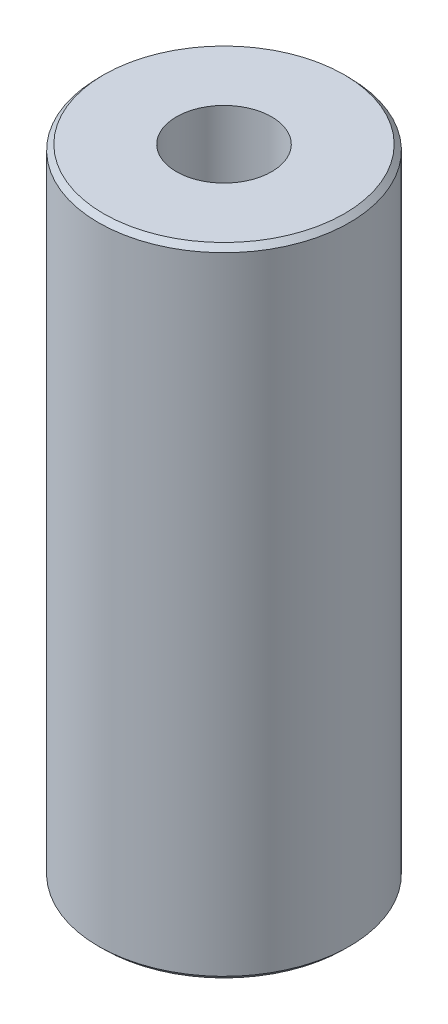
from build123d import *
from OCP.BRepFilletAPI import BRepFilletAPI_MakeChamfer

# Parameters (mm, degrees)
SKETCH1_R           = 10
BOSS_EXTRUDE1_DEPTH = 50.778041185
SKETCH2_R           = 3.795132804
CUT_EXTRUDE1_DEPTH  = 53.710620055
CHAMFER1_SIZE       = 0.416045283
CHAMFER1_SIZE2      = 0.406846227


with BuildPart() as part:
    # Sketch1 → Boss-Extrude1 (new body)
    with BuildSketch(Plane(origin=(0, 0, 0), x_dir=(1, 0, 0), z_dir=(0, 1, 0))):
        Circle(SKETCH1_R)
    extrude(amount=BOSS_EXTRUDE1_DEPTH)

    # Sketch2 → Cut-Extrude1 (cut, through all)
    with BuildSketch(Plane(origin=(0, 0, 0), x_dir=(1, 0, 0), z_dir=(0, 1, 0))):
        Circle(SKETCH2_R)
    extrude(amount=CUT_EXTRUDE1_DEPTH, mode=Mode.SUBTRACT)

    # Chamfer1: one chamfer whose edges measure the first distance from different faces: ONE call of the kernel's chamfer builder (chamfer() names one face for all edges)
    chamfer1_edges_1 = [part.edges().sort_by_distance(p)[0] for p in [
        (-10, 50.778041185, 0),
    ]]
    chamfer1_side_1 = [part.faces().sort_by_distance(p)[0] for p in [
        (-10, 25.389020592, 0),
    ]]
    chamfer1_edges_2 = [part.edges().sort_by_distance(p)[0] for p in [
        (-10, 0, 0),
    ]]
    chamfer1_side_2 = [part.faces().sort_by_distance(p)[0] for p in [
        (-9.717157288, 0, 0),
    ]]
    chamfer1 = BRepFilletAPI_MakeChamfer(part.part.solid().wrapped)
    for e in chamfer1_edges_1:
        chamfer1.Add(CHAMFER1_SIZE, CHAMFER1_SIZE2, e.wrapped, chamfer1_side_1[0].wrapped)  # the first distance lies on this face
    for e in chamfer1_edges_2:
        chamfer1.Add(CHAMFER1_SIZE, CHAMFER1_SIZE2, e.wrapped, chamfer1_side_2[0].wrapped)  # the first distance lies on this face
    add(Compound.cast(chamfer1.Shape()), mode=Mode.REPLACE)


solid = part.part
